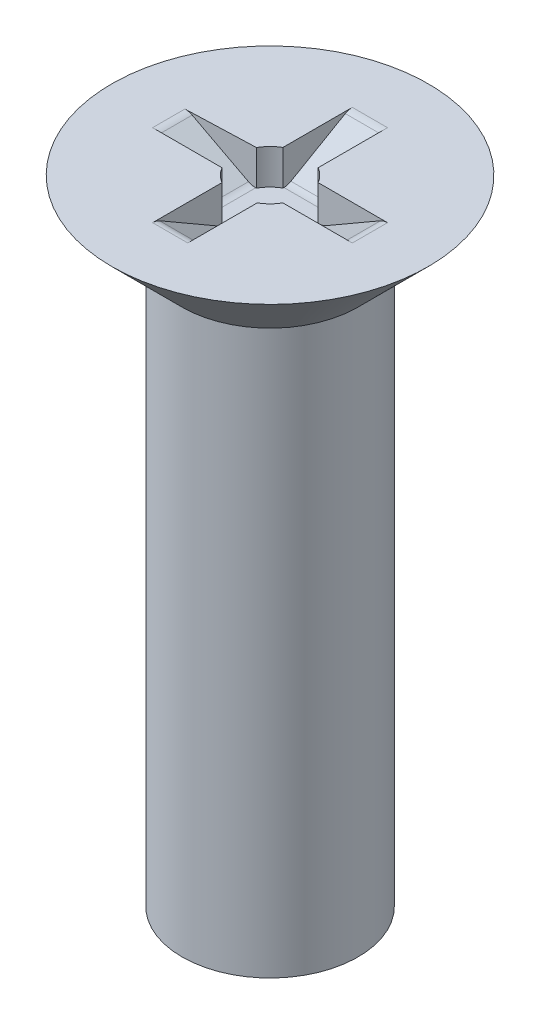
from build123d import *

# Parameters (mm, degrees)
SKETCH1_R           = 1.25
BOSS_EXTRUDE1_DEPTH = 8
SKETCH3_R           = 2.25
BOSS_EXTRUDE2_DEPTH = 1
CHAMFER3_SIZE       = 1
SKETCH4_R           = 0.5
CUT_EXTRUDE1_DEPTH  = 0.5
CUT_EXTRUDE2_DEPTH  = 0.25
CIRPATTERN1_COUNT   = 4
DRAFT1_ANGLE        = 2
FILLET4_R           = 0.2


with BuildPart() as part:
    # Sketch1 → Boss-Extrude1 (new body)
    with BuildSketch(Plane(origin=(0, 0, 0), x_dir=(1, 0, 0), z_dir=(0, 1, 0))):
        with Locations(Location((0, 0, 0), (0, 0, 270))):
            Circle(SKETCH1_R)
    extrude(amount=BOSS_EXTRUDE1_DEPTH)

    # Sketch3 → Boss-Extrude2 (add)
    with BuildSketch(Plane(origin=(0, 8, 0), x_dir=(1, 0, 0), z_dir=(0, 1, 0))):
        with Locations(Location((0, 0, 0), (0, 0, 270))):
            Circle(SKETCH3_R)
    extrude(amount=BOSS_EXTRUDE2_DEPTH)

    # Chamfer3
    chamfer3_edges = [part.edges().sort_by_distance(p)[0] for p in [
        (0, 8, -2.25),
    ]]
    chamfer(chamfer3_edges, length=CHAMFER3_SIZE - 0.0001)  # a hair under: the kernel refuses the full size

    # Sketch4 → Cut-Extrude1 (cut)
    with BuildSketch(Plane(origin=(0, 9, 0), x_dir=(1, 0, 0), z_dir=(0, 1, 0))):
        with Locations(Location((0, 0, 0), (0, 0, 270))):
            Circle(SKETCH4_R)
    extrude(amount=-CUT_EXTRUDE1_DEPTH, mode=Mode.SUBTRACT)

    # Sketch5 → Cut-Extrude2 (cut, symmetric)
    with BuildSketch(Plane.XY):
        Polygon((0.5, 8.5), (1.366025404, 9), (0.5, 9), (0.25, 9), (0.25, 8.5), align=None)
    cut_extrude2 = extrude(amount=CUT_EXTRUDE2_DEPTH, both=True, mode=Mode.SUBTRACT)

    # CirPattern1: Cut-Extrude2 ×4 about axis
    cirpattern1_axis = Axis((0, 0, 0), (0, 1, 0))
    for i in range(1, CIRPATTERN1_COUNT):
        add(cut_extrude2.rotate(cirpattern1_axis, i * 360 / CIRPATTERN1_COUNT), mode=Mode.SUBTRACT)

    # Draft1
    draft1_faces = [part.faces().sort_by_distance(p)[0] for p in [
        (-0.745512702, 8.822168784, -0.25),
    ]]
    draft(draft1_faces, Plane(origin=(-0.25, 0, 0), x_dir=(0, 0, 1), z_dir=(1, 0, 0)), DRAFT1_ANGLE)

    # Fillet4
    fillet4_edges = [part.edges().sort_by_distance(p)[0] for p in [
        (0.5, 8.5, 0),
        (1.366025404, 9, 0),
        (0, 8.5, -0.5),
        (0, 9, -1.366025404),
        (0, 9, 1.366025404),
        (-0.5, 8.5, 0.004365096),
        (-1.366025404, 9, 0.019486233),
    ]]
    fillet(fillet4_edges, radius=FILLET4_R)


solid = part.part
